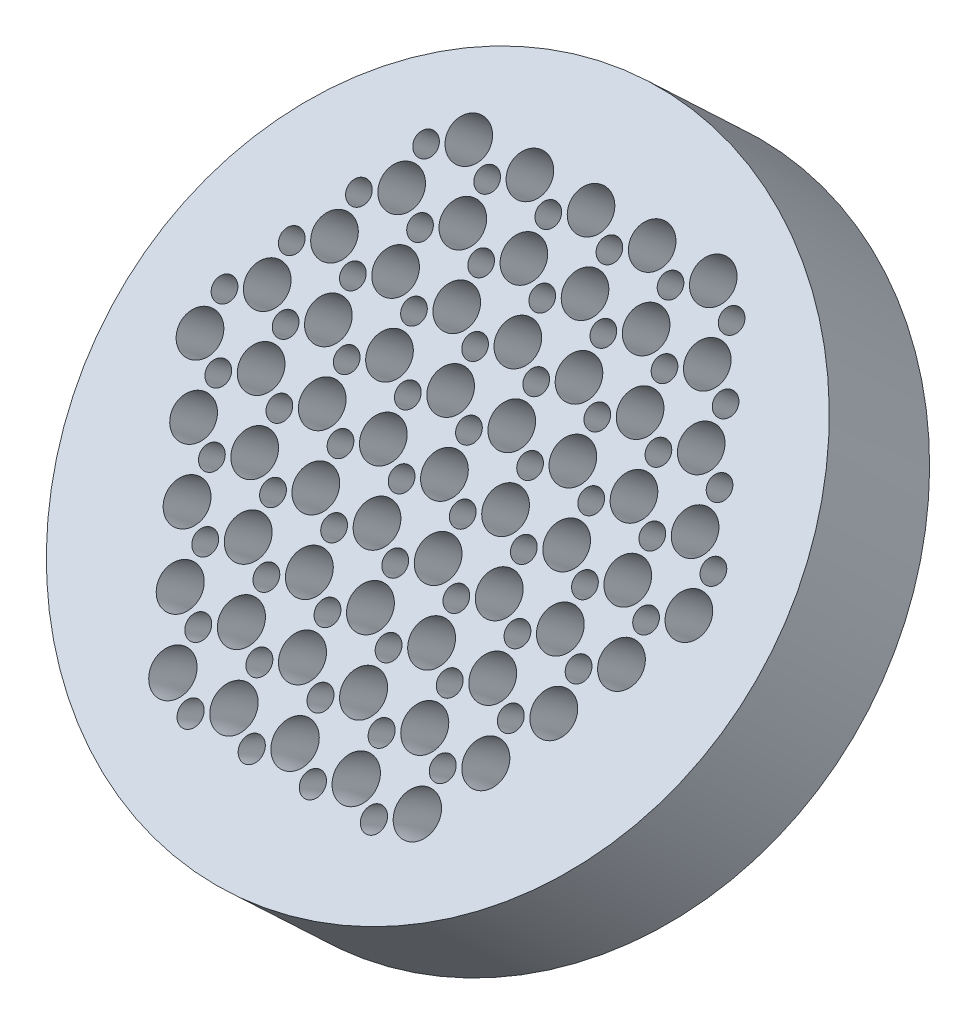
from build123d import *

# Parameters (mm, degrees)
SKETCH1_R               = 18.646817389
SKETCH1_R_2             = 1.25
SKETCH1_R_3             = 0.7
SKETCH5_R               = 30
SKETCH5_R_2             = 17.173669099
BOSS_EXTRUDE1_DEPTH     = 4
FILLET1_R               = 2
SKETCH6_R               = 1.75
CUT_EXTRUDE2_DEPTH      = 5
SKETCH8_R               = 1.75
CUT_EXTRUDE3_DEPTH      = 5
CUT_EXTRUDE7_DEPTH      = 74.872306678
CUT_EXTRUDE7_DEPTH_BACK = 74.872306678
SKETCH19_R              = 20.7
SKETCH19_R_2            = 17.769545111
BOSS_EXTRUDE4_DEPTH     = 9
SKETCH20_R              = 25
SKETCH20_R_2            = 20.6
CUT_EXTRUDE12_DEPTH     = 9
SKETCH21_R              = 38.070105261
CUT_EXTRUDE13_DEPTH     = 0.2


with BuildPart() as part:
    # Sweep1: sweep along a path in Sketch2
    with BuildLine(Plane(origin=(0, 0, 0), x_dir=(0, 0, -1), z_dir=(1, 0, 0))) as sweep1_path:
        Line((0, 0), (12, 0))
        ThreePointArc((12, 0), (31.391260893, -8.032123253), (39.423384146, -27.423384146))
        Line((39.423384146, -27.423384146), (39.423384146, -34.423384146))
    # Sketch1 → Sweep1 (sweep)
    with BuildSketch(Plane.XY):
        Circle(SKETCH1_R)
        Circle(SKETCH1_R_2, mode=Mode.SUBTRACT)
        with Locations((3.9, 0)):
            Circle(SKETCH1_R_2, mode=Mode.SUBTRACT)
        with Locations((7.8, 0)):
            Circle(SKETCH1_R_2, mode=Mode.SUBTRACT)
        with Locations((11.7, 0)):
            Circle(SKETCH1_R_2, mode=Mode.SUBTRACT)
        with Locations((15.6, 0)):
            Circle(SKETCH1_R_2, mode=Mode.SUBTRACT)
        with Locations((1.95, -3.377499075)):
            Circle(SKETCH1_R_2, mode=Mode.SUBTRACT)
        with Locations((3.9, -6.75499815)):
            Circle(SKETCH1_R_2, mode=Mode.SUBTRACT)
        with Locations((5.85, -10.132497224)):
            Circle(SKETCH1_R_2, mode=Mode.SUBTRACT)
        with Locations((7.8, -13.509996299)):
            Circle(SKETCH1_R_2, mode=Mode.SUBTRACT)
        with Locations((-1.95, -3.377499075)):
            Circle(SKETCH1_R_2, mode=Mode.SUBTRACT)
        with Locations((-3.9, -6.75499815)):
            Circle(SKETCH1_R_2, mode=Mode.SUBTRACT)
        with Locations((-5.85, -10.132497224)):
            Circle(SKETCH1_R_2, mode=Mode.SUBTRACT)
        with Locations((-7.8, -13.509996299)):
            Circle(SKETCH1_R_2, mode=Mode.SUBTRACT)
        with Locations((-3.9, 0)):
            Circle(SKETCH1_R_2, mode=Mode.SUBTRACT)
        with Locations((-7.8, 0)):
            Circle(SKETCH1_R_2, mode=Mode.SUBTRACT)
        with Locations((-11.7, 0)):
            Circle(SKETCH1_R_2, mode=Mode.SUBTRACT)
        with Locations((-15.6, 0)):
            Circle(SKETCH1_R_2, mode=Mode.SUBTRACT)
        with Locations((-1.95, 3.377499075)):
            Circle(SKETCH1_R_2, mode=Mode.SUBTRACT)
        with Locations((-3.9, 6.75499815)):
            Circle(SKETCH1_R_2, mode=Mode.SUBTRACT)
        with Locations((-5.85, 10.132497224)):
            Circle(SKETCH1_R_2, mode=Mode.SUBTRACT)
        with Locations((-7.8, 13.509996299)):
            Circle(SKETCH1_R_2, mode=Mode.SUBTRACT)
        with Locations((1.95, 3.377499075)):
            Circle(SKETCH1_R_2, mode=Mode.SUBTRACT)
        with Locations((3.9, 6.75499815)):
            Circle(SKETCH1_R_2, mode=Mode.SUBTRACT)
        with Locations((5.85, 10.132497224)):
            Circle(SKETCH1_R_2, mode=Mode.SUBTRACT)
        with Locations((7.8, 13.509996299)):
            Circle(SKETCH1_R_2, mode=Mode.SUBTRACT)
        with Locations((5.85, 3.377499075)):
            Circle(SKETCH1_R_2, mode=Mode.SUBTRACT)
        with Locations((7.8, 6.75499815)):
            Circle(SKETCH1_R_2, mode=Mode.SUBTRACT)
        with Locations((9.75, 3.377499075)):
            Circle(SKETCH1_R_2, mode=Mode.SUBTRACT)
        with Locations((11.7, 6.75499815)):
            Circle(SKETCH1_R_2, mode=Mode.SUBTRACT)
        with Locations((9.749099848, 10.134056333)):
            Circle(SKETCH1_R_2, mode=Mode.SUBTRACT)
        with Locations((13.650900152, 3.375939966)):
            Circle(SKETCH1_R_2, mode=Mode.SUBTRACT)
        with Locations((5.850000208, -3.379058003)):
            Circle(SKETCH1_R_2, mode=Mode.SUBTRACT)
        with Locations((9.750000208, -3.379058003)):
            Circle(SKETCH1_R_2, mode=Mode.SUBTRACT)
        with Locations((7.800000208, -6.756557078)):
            Circle(SKETCH1_R_2, mode=Mode.SUBTRACT)
        with Locations((11.700000208, -6.756557078)):
            Circle(SKETCH1_R_2, mode=Mode.SUBTRACT)
        with Locations((9.749100056, -10.135615261)):
            Circle(SKETCH1_R_2, mode=Mode.SUBTRACT)
        with Locations((13.650900359, -3.377498895)):
            Circle(SKETCH1_R_2, mode=Mode.SUBTRACT)
        with Locations((-0.00134976, -6.757336722)):
            Circle(SKETCH1_R_2, mode=Mode.SUBTRACT)
        with Locations((1.94865024, -10.134835797)):
            Circle(SKETCH1_R_2, mode=Mode.SUBTRACT)
        with Locations((-1.95134976, -10.134835797)):
            Circle(SKETCH1_R_2, mode=Mode.SUBTRACT)
        with Locations((-0.00134976, -13.512334872)):
            Circle(SKETCH1_R_2, mode=Mode.SUBTRACT)
        with Locations((-3.903150063, -13.512334872)):
            Circle(SKETCH1_R_2, mode=Mode.SUBTRACT)
        with Locations((3.900450543, -13.512334872)):
            Circle(SKETCH1_R_2, mode=Mode.SUBTRACT)
        with Locations((-5.852699936, -3.379058363)):
            Circle(SKETCH1_R_2, mode=Mode.SUBTRACT)
        with Locations((-7.802699936, -6.756557438)):
            Circle(SKETCH1_R_2, mode=Mode.SUBTRACT)
        with Locations((-9.752699936, -3.379058363)):
            Circle(SKETCH1_R_2, mode=Mode.SUBTRACT)
        with Locations((-11.702699936, -6.756557438)):
            Circle(SKETCH1_R_2, mode=Mode.SUBTRACT)
        with Locations((-13.653600087, -3.377499255)):
            Circle(SKETCH1_R_2, mode=Mode.SUBTRACT)
        with Locations((-9.751799784, -10.135615621)):
            Circle(SKETCH1_R_2, mode=Mode.SUBTRACT)
        with Locations((-5.852700144, 3.377498715)):
            Circle(SKETCH1_R_2, mode=Mode.SUBTRACT)
        with Locations((-9.752700144, 3.377498715)):
            Circle(SKETCH1_R_2, mode=Mode.SUBTRACT)
        with Locations((-7.802700144, 6.75499779)):
            Circle(SKETCH1_R_2, mode=Mode.SUBTRACT)
        with Locations((-11.702700144, 6.75499779)):
            Circle(SKETCH1_R_2, mode=Mode.SUBTRACT)
        with Locations((-9.751799992, 10.134055973)):
            Circle(SKETCH1_R_2, mode=Mode.SUBTRACT)
        with Locations((-13.653600295, 3.375939606)):
            Circle(SKETCH1_R_2, mode=Mode.SUBTRACT)
        with Locations((-0.001350176, 6.755777434)):
            Circle(SKETCH1_R_2, mode=Mode.SUBTRACT)
        with Locations((-1.951350176, 10.133276509)):
            Circle(SKETCH1_R_2, mode=Mode.SUBTRACT)
        with Locations((1.948649824, 10.133276509)):
            Circle(SKETCH1_R_2, mode=Mode.SUBTRACT)
        with Locations((-0.001350176, 13.510775583)):
            Circle(SKETCH1_R_2, mode=Mode.SUBTRACT)
        with Locations((3.900450128, 13.510775583)):
            Circle(SKETCH1_R_2, mode=Mode.SUBTRACT)
        with Locations((-3.903150479, 13.510775583)):
            Circle(SKETCH1_R_2, mode=Mode.SUBTRACT)
        with Locations((13.65, -1.125833025)):
            Circle(SKETCH1_R_3, mode=Mode.SUBTRACT)
        with Locations((11.700900359, -4.504371325)):
            Circle(SKETCH1_R_3, mode=Mode.SUBTRACT)
        with Locations((9.750000208, -7.883429509)):
            Circle(SKETCH1_R_3, mode=Mode.SUBTRACT)
        with Locations((7.798650344, -11.259109473)):
            Circle(SKETCH1_R_3, mode=Mode.SUBTRACT)
        with Locations((9.75, -1.125833025)):
            Circle(SKETCH1_R_3, mode=Mode.SUBTRACT)
        with Locations((7.800900359, -4.504371325)):
            Circle(SKETCH1_R_3, mode=Mode.SUBTRACT)
        with Locations((5.850000208, -7.883429509)):
            Circle(SKETCH1_R_3, mode=Mode.SUBTRACT)
        with Locations((3.898650344, -11.259109473)):
            Circle(SKETCH1_R_3, mode=Mode.SUBTRACT)
        with Locations((5.85, -1.125833025)):
            Circle(SKETCH1_R_3, mode=Mode.SUBTRACT)
        with Locations((3.900900359, -4.504371325)):
            Circle(SKETCH1_R_3, mode=Mode.SUBTRACT)
        with Locations((1.950000208, -7.883429509)):
            Circle(SKETCH1_R_3, mode=Mode.SUBTRACT)
        with Locations((-0.001349656, -11.259109473)):
            Circle(SKETCH1_R_3, mode=Mode.SUBTRACT)
        with Locations((1.95, -1.125833025)):
            Circle(SKETCH1_R_3, mode=Mode.SUBTRACT)
        with Locations((0.000900359, -4.504371325)):
            Circle(SKETCH1_R_3, mode=Mode.SUBTRACT)
        with Locations((-1.949999792, -7.883429509)):
            Circle(SKETCH1_R_3, mode=Mode.SUBTRACT)
        with Locations((-3.901349656, -11.259109473)):
            Circle(SKETCH1_R_3, mode=Mode.SUBTRACT)
        with Locations((-1.95, -1.125833025)):
            Circle(SKETCH1_R_3, mode=Mode.SUBTRACT)
        with Locations((-3.899099641, -4.504371325)):
            Circle(SKETCH1_R_3, mode=Mode.SUBTRACT)
        with Locations((-5.849999792, -7.883429509)):
            Circle(SKETCH1_R_3, mode=Mode.SUBTRACT)
        with Locations((-7.801349656, -11.259109473)):
            Circle(SKETCH1_R_3, mode=Mode.SUBTRACT)
        with Locations((-5.85, -1.125833025)):
            Circle(SKETCH1_R_3, mode=Mode.SUBTRACT)
        with Locations((-7.799099641, -4.504371325)):
            Circle(SKETCH1_R_3, mode=Mode.SUBTRACT)
        with Locations((-9.749999792, -7.883429509)):
            Circle(SKETCH1_R_3, mode=Mode.SUBTRACT)
        with Locations((-9.75, -1.125833025)):
            Circle(SKETCH1_R_3, mode=Mode.SUBTRACT)
        with Locations((-11.699099641, -4.504371325)):
            Circle(SKETCH1_R_3, mode=Mode.SUBTRACT)
        with Locations((-13.65, -1.125833025)):
            Circle(SKETCH1_R_3, mode=Mode.SUBTRACT)
        with Locations((0, 2.25166605)):
            Circle(SKETCH1_R_3, mode=Mode.SUBTRACT)
        with Locations((3.9, 2.25166605)):
            Circle(SKETCH1_R_3, mode=Mode.SUBTRACT)
        with Locations((7.8, 2.25166605)):
            Circle(SKETCH1_R_3, mode=Mode.SUBTRACT)
        with Locations((11.7, 2.25166605)):
            Circle(SKETCH1_R_3, mode=Mode.SUBTRACT)
        with Locations((15.6, 2.25166605)):
            Circle(SKETCH1_R_3, mode=Mode.SUBTRACT)
        with Locations((1.949100056, 5.629684708)):
            Circle(SKETCH1_R_3, mode=Mode.SUBTRACT)
        with Locations((5.849100056, 5.629684708)):
            Circle(SKETCH1_R_3, mode=Mode.SUBTRACT)
        with Locations((9.749100056, 5.629684708)):
            Circle(SKETCH1_R_3, mode=Mode.SUBTRACT)
        with Locations((13.649100056, 5.629684708)):
            Circle(SKETCH1_R_3, mode=Mode.SUBTRACT)
        with Locations((3.899100056, 9.007183782)):
            Circle(SKETCH1_R_3, mode=Mode.SUBTRACT)
        with Locations((7.799100056, 9.007183782)):
            Circle(SKETCH1_R_3, mode=Mode.SUBTRACT)
        with Locations((11.699100056, 9.007183782)):
            Circle(SKETCH1_R_3, mode=Mode.SUBTRACT)
        with Locations((5.85, 12.384163274)):
            Circle(SKETCH1_R_3, mode=Mode.SUBTRACT)
        with Locations((9.75, 12.384163274)):
            Circle(SKETCH1_R_3, mode=Mode.SUBTRACT)
        with Locations((5.85, -14.635829324)):
            Circle(SKETCH1_R_3, mode=Mode.SUBTRACT)
        with Locations((1.950899944, -14.635309741)):
            Circle(SKETCH1_R_3, mode=Mode.SUBTRACT)
        with Locations((-1.949100056, -14.635309741)):
            Circle(SKETCH1_R_3, mode=Mode.SUBTRACT)
        with Locations((-5.85, -14.635829324)):
            Circle(SKETCH1_R_3, mode=Mode.SUBTRACT)
        with Locations((-15.6, 2.25166605)):
            Circle(SKETCH1_R_3, mode=Mode.SUBTRACT)
        with Locations((-13.65, 5.628125959)):
            Circle(SKETCH1_R_3, mode=Mode.SUBTRACT)
        with Locations((-11.7, 9.005625033)):
            Circle(SKETCH1_R_3, mode=Mode.SUBTRACT)
        with Locations((-9.75, 12.384163274)):
            Circle(SKETCH1_R_3, mode=Mode.SUBTRACT)
        with Locations((-5.85, 12.384163274)):
            Circle(SKETCH1_R_3, mode=Mode.SUBTRACT)
        with Locations((-1.95, 12.384163274)):
            Circle(SKETCH1_R_3, mode=Mode.SUBTRACT)
        with Locations((1.95, 12.384163274)):
            Circle(SKETCH1_R_3, mode=Mode.SUBTRACT)
        with Locations((-7.8, 9.005625033)):
            Circle(SKETCH1_R_3, mode=Mode.SUBTRACT)
        with Locations((-9.75, 5.628125959)):
            Circle(SKETCH1_R_3, mode=Mode.SUBTRACT)
        with Locations((-11.7, 2.25166605)):
            Circle(SKETCH1_R_3, mode=Mode.SUBTRACT)
        with Locations((-3.9, 9.005625033)):
            Circle(SKETCH1_R_3, mode=Mode.SUBTRACT)
        with Locations((-5.85, 5.628125959)):
            Circle(SKETCH1_R_3, mode=Mode.SUBTRACT)
        with Locations((-7.8, 2.25166605)):
            Circle(SKETCH1_R_3, mode=Mode.SUBTRACT)
        with Locations((0, 9.005625033)):
            Circle(SKETCH1_R_3, mode=Mode.SUBTRACT)
        with Locations((-1.95, 5.628125959)):
            Circle(SKETCH1_R_3, mode=Mode.SUBTRACT)
        with Locations((-3.9, 2.25166605)):
            Circle(SKETCH1_R_3, mode=Mode.SUBTRACT)
    sweep(path=sweep1_path.line)

    # Sketch5 → Boss-Extrude1 (add)
    with BuildSketch(Plane.XY):
        Circle(SKETCH5_R)
        Circle(SKETCH5_R_2, mode=Mode.SUBTRACT)
    extrude(amount=-BOSS_EXTRUDE1_DEPTH)

    # Fillet1
    fillet1_edges = [part.edges().sort_by_distance(p)[0] for p in [
        (-18.646817389, 0, -4),
    ]]
    fillet(fillet1_edges, radius=FILLET1_R)

    # Sketch6 → Cut-Extrude2 (cut)
    with BuildSketch(Plane.XY):
        with Locations((23.5, 0)):
            Circle(SKETCH6_R)
        with Locations((0, -23.5)):
            Circle(SKETCH6_R)
        with Locations((-23.5, 0)):
            Circle(SKETCH6_R)
        with Locations((0, 23.5)):
            Circle(SKETCH6_R)
    extrude(amount=-CUT_EXTRUDE2_DEPTH, mode=Mode.SUBTRACT)

    # Sketch8 → Cut-Extrude3 (cut)
    with BuildSketch(Plane.XY):
        with Locations((-18.03122292, 18.03122292)):
            Circle(SKETCH8_R)
        with Locations((18.03122292, 18.03122292)):
            Circle(SKETCH8_R)
        with Locations((18.03122292, -18.03122292)):
            Circle(SKETCH8_R)
        with Locations((-18.03122292, -18.03122292)):
            Circle(SKETCH8_R)
    extrude(amount=-CUT_EXTRUDE3_DEPTH, mode=Mode.SUBTRACT)

    # Sketch9 → Cut-Extrude7 (cut, two sides: drawn at the far end of the back side and taken through both)
    with BuildSketch(Plane(origin=(0, 0, 0), x_dir=(0, 0, -1), z_dir=(1, 0, 0)).offset(-CUT_EXTRUDE7_DEPTH_BACK)):
        Polygon((3.484456486, -37.737567568), (7.727990651, -25.394351674), (43.74744986, 12.796998158), (52.039012958, 41.263827663), (-16.271676223, 41.263827663), (-16.271676223, -37.737567568), align=None)
        Polygon((50.294858335, 6.621931983), (14.275399126, -31.569417849), (12.125804446, -37.821968246), (69.948520059, -37.821968246), align=None)
    extrude(amount=CUT_EXTRUDE7_DEPTH + CUT_EXTRUDE7_DEPTH_BACK, mode=Mode.SUBTRACT)

    # Sketch19 → Boss-Extrude4 (add)
    with BuildSketch(Plane(origin=(0, -15.81198983, -16.765416484), x_dir=(1, 0, 0), z_dir=(0, 0.6861184638170621, 0.727489830588246))):
        with Locations((0, 14.729202186)):
            Circle(SKETCH19_R)
        with Locations((0, 14.729202186)):
            Circle(SKETCH19_R_2, mode=Mode.SUBTRACT)
    extrude(amount=-BOSS_EXTRUDE4_DEPTH)

    # Sketch20 → Cut-Extrude12 (cut)
    with BuildSketch(Plane(origin=(0, -15.81198983, -16.765416484), x_dir=(1, 0, 0), z_dir=(0, 0.6861184638170621, 0.727489830588246))):
        with Locations((0, 14.717501202)):
            Circle(SKETCH20_R)
        with Locations((0, 14.717501202)):
            Circle(SKETCH20_R_2, mode=Mode.SUBTRACT)
    extrude(amount=-CUT_EXTRUDE12_DEPTH, mode=Mode.SUBTRACT)

    # Sketch21 → Cut-Extrude13 (cut)
    with BuildSketch(Plane(origin=(0, -21.987056005, -23.312824959), x_dir=(-1, 0, 0), z_dir=(0, -0.6861184638170619, -0.7274898305882462))):
        with Locations((-4.786631218, 12.571268178)):
            Circle(SKETCH21_R)
    extrude(amount=-CUT_EXTRUDE13_DEPTH, mode=Mode.SUBTRACT)


solid = part.part
